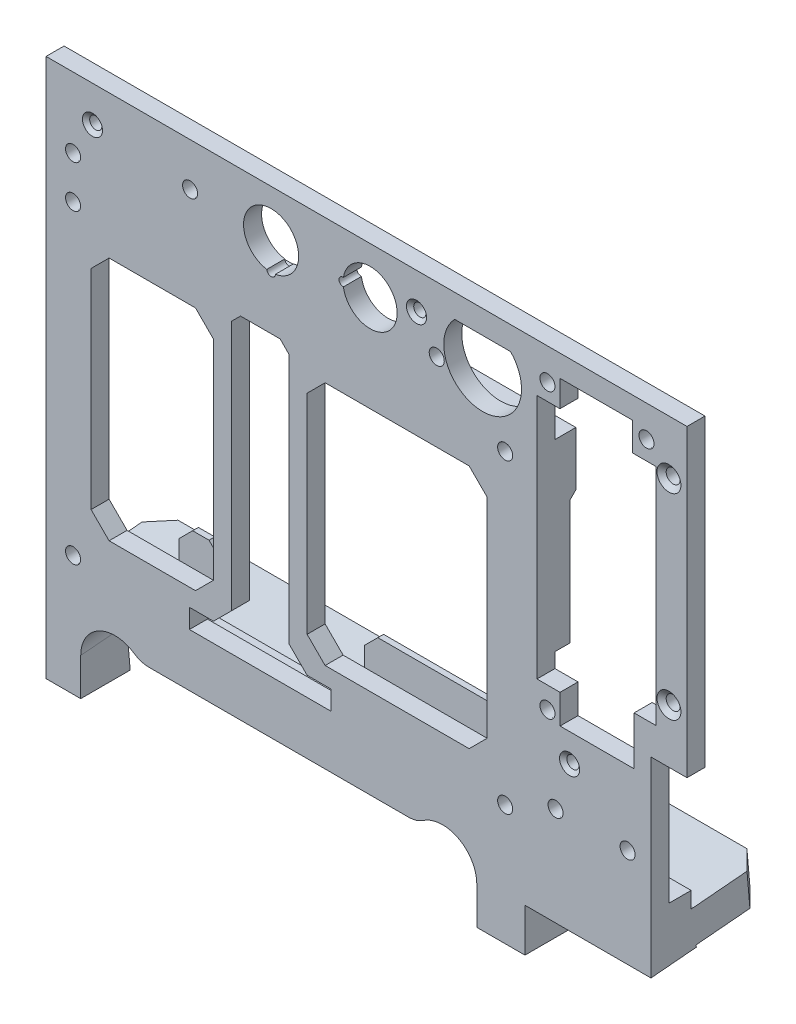
from build123d import *

# Parameters (mm, degrees)
BOSS_EXTRUDE1_DEPTH                               = 6.35
CSK_FOR_8_FLAT_HEAD_MACHINE_SCREW_100_D           = 4.9149
CSK_FOR_8_FLAT_HEAD_MACHINE_SCREW_100_CSINK_D     = 8.4328
CSK_FOR_8_FLAT_HEAD_MACHINE_SCREW_100_CSINK_ANGLE = 100
F_6_CLEARANCE_HOLE1_D                             = 4.3053
F_6_PLASTIC_INSERT_AT_2_COUNT                     = 2
F_6_PLASTIC_INSERT_AT_2_PITCH                     = 25.4
F_6_PLASTIC_INSERT_AT_3_COUNT                     = 2
F_6_PLASTIC_INSERT_AT_3_PITCH                     = 43.847198314
F_6_PLASTIC_INSERT_AT_4_COUNT                     = 2
F_6_PLASTIC_INSERT_AT_4_PITCH                     = 195.728385269
F_6_PLASTIC_INSERT_AT_5_COUNT                     = 2
F_6_PLASTIC_INSERT_AT_5_PITCH                     = 219.81275054
F_6_PLASTIC_INSERT_AT_6_COUNT                     = 2
F_6_PLASTIC_INSERT_AT_6_PITCH                     = 109.227383471
F_6_PLASTIC_INSERT_AT_7_COUNT                     = 2
F_6_PLASTIC_INSERT_AT_7_PITCH                     = 135.11667516
F_6_PLASTIC_INSERT_AT_8_COUNT                     = 2
F_6_PLASTIC_INSERT_AT_8_PITCH                     = 198.442579935
F_6_PLASTIC_INSERT_AT_9_COUNT                     = 2
F_6_PLASTIC_INSERT_AT_9_PITCH                     = 227.0125
F_6_PLASTIC_INSERT_AT_10_COUNT                    = 2
F_6_PLASTIC_INSERT_AT_10_PITCH                    = 40.413646983
F_6_PLASTIC_INSERT_AT_11_COUNT                    = 2
F_6_PLASTIC_INSERT_AT_11_PITCH                    = 131.96584911
F_6_PLASTIC_INSERT_AT_12_COUNT                    = 2
F_6_PLASTIC_INSERT_AT_12_PITCH                    = 129.077320166
EXTRUDE_THIN1_DEPTH                               = 5.334
SKETCH32_W                                        = 20.32
SKETCH32_H                                        = 104.32703176
CUT_EXTRUDE1_DEPTH                                = 2466.937509601
SKETCH46_W                                        = 50
SKETCH46_H                                        = 6.778216606
CUT_EXTRUDE2_DEPTH                                = 2466.937509601
SKETCH47_W                                        = 6.35
SKETCH47_H                                        = 20
CUT_EXTRUDE3_DEPTH                                = 5.334
CHAMFER1_SIZE                                     = 6.35
CHAMFER2_SIZE                                     = 3.175
SKETCH51_W                                        = 38.317668231
SKETCH51_H                                        = 13.297875423
CUT_EXTRUDE4_DEPTH                                = 5.334
BOSS_EXTRUDE6_REACH                               = 2467.938
SKETCH53_W                                        = 213.36
SKETCH53_H                                        = 34.925
CAVITY1_START                                     = -216.085930602
CAVITY1_OUTLINE_W                                 = 44.45
CAVITY1_OUTLINE_H                                 = 18.31517219
CAVITY1_DEPTH                                     = 17.38195068
CUT_EXTRUDE5_REACH                                = 2490.533
SKETCH54_W                                        = 2.919570665
SKETCH54_H                                        = 5.651221012
BOSS_EXTRUDE7_START                               = -213.36
BOSS_EXTRUDE7_DEPTH                               = 213.36
CUT_EXTRUDE6_DEPTH                                = 1.5875
CSK_FOR_8_FLAT_HEAD_MACHINE_SCREW_2_D             = 4.9149
CSK_FOR_8_FLAT_HEAD_MACHINE_SCREW_2_CSINK_D       = 15.6977334
CSK_FOR_8_FLAT_HEAD_MACHINE_SCREW_2_CSINK_ANGLE   = 100
CHAMFER4_SIZE                                     = 6.35
SKETCH59_W                                        = 74.081135827
SKETCH59_H                                        = 19.05
SKETCH59_W_2                                      = 172.129604807
SKETCH59_W_3                                      = 15.323166325
BOSS_EXTRUDE8_DEPTH                               = 2.032
CHAMFER5_SIZE                                     = 4.7625
CHAMFER6_SIZE                                     = 2.032
CSK_FOR_6_FLAT_HEAD_MACHINE_SCREW_100_D           = 4.3053
CSK_FOR_6_FLAT_HEAD_MACHINE_SCREW_100_CSINK_D     = 7.0866
CSK_FOR_6_FLAT_HEAD_MACHINE_SCREW_100_CSINK_ANGLE = 100


# Read off the part's stored shape, not the designer's step: Cavity1
with BuildPart() as part:
    # Sketch1 → Boss-Extrude1 (new body)
    with BuildSketch(Plane.XY.offset(-6.35)):
        Polygon((312.420000001, -2444.383004154), (312.420000001, -2396.543225166), (325.120000001, -2396.543225166), (325.120000001, -2289.228225166), (99.060000001, -2289.228225166), (99.060000001, -2444.383004154), align=None)
    extrude(amount=BOSS_EXTRUDE1_DEPTH)

    # CSK for _8 Flat Head Machine Screw _100 (through all)
    with Locations(Plane.XY):
        with Locations((318.770000001, -2308.278225166), (318.770000001, -2377.493225166)):
            CounterSinkHole(CSK_FOR_8_FLAT_HEAD_MACHINE_SCREW_100_D / 2, CSK_FOR_8_FLAT_HEAD_MACHINE_SCREW_100_CSINK_D / 2, counter_sink_angle=CSK_FOR_8_FLAT_HEAD_MACHINE_SCREW_100_CSINK_ANGLE)

    # #6 Clearance Hole1 (through all)
    with Locations(Plane(origin=(364.651150828, -2391.952939809, 0), x_dir=(1, 0, 0), z_dir=(0, 0, 1))):
        with Locations((-60.486150827, -37.292785356), (-85.886150827, -37.292785356), (-103.666150827, -44.912785356), (-256.066150827, -44.912785356), (-256.066150827, 63.037214644), (-103.666150827, 63.037214644), (-127.796150827, 79.864714644), (-214.791150827, 87.484714644), (-256.066150827, 77.959714644), (-88.743650827, 91.612214644), (-53.818650827, 91.612214644), (-88.743650827, -8.400285356)):
            Hole(F_6_CLEARANCE_HOLE1_D / 2)

    # Sketch5 → #6 Plastic Insert (revolve, cut)
    with BuildSketch(Plane(origin=(304.165000001, -2429.245725165, 0), x_dir=(0, -1, 0), z_dir=(1, 0, 0))):
        Polygon((0, 0), (0, 3.81), (2.5273, 3.81), (2.6543, 0), align=None)
    f_6_plastic_insert = revolve(axis=Axis((304.165000001, -2429.245725165, -110), (0, 0, 1)), mode=Mode.SUBTRACT)

    # #6 Plastic Insert at 2: #6 Plastic Insert ×2
    with Locations(*[(-i * F_6_PLASTIC_INSERT_AT_2_PITCH, 0, 0) for i in range(1, F_6_PLASTIC_INSERT_AT_2_COUNT)]):
        add(f_6_plastic_insert, mode=Mode.SUBTRACT)

    # #6 Plastic Insert at 3: #6 Plastic Insert ×2
    with Locations(*[Vector(-0.9847835588178597, -0.17378533390948422, 0) * (i * F_6_PLASTIC_INSERT_AT_3_PITCH) for i in range(1, F_6_PLASTIC_INSERT_AT_3_COUNT)]):
        add(f_6_plastic_insert, mode=Mode.SUBTRACT)

    # #6 Plastic Insert at 4: #6 Plastic Insert ×2
    with Locations(*[Vector(-0.9992418817088248, -0.038931501884812016, 0) * (i * F_6_PLASTIC_INSERT_AT_4_PITCH) for i in range(1, F_6_PLASTIC_INSERT_AT_4_COUNT)]):
        add(f_6_plastic_insert, mode=Mode.SUBTRACT)

    # #6 Plastic Insert at 5: #6 Plastic Insert ×2
    with Locations(*[Vector(-0.8897573026106963, 0.4564339409497698, 0) * (i * F_6_PLASTIC_INSERT_AT_5_PITCH) for i in range(1, F_6_PLASTIC_INSERT_AT_5_COUNT)]):
        add(f_6_plastic_insert, mode=Mode.SUBTRACT)

    # #6 Plastic Insert at 6: #6 Plastic Insert ×2
    with Locations(*[Vector(-0.39532211271238615, 0.9185425560095817, 0) * (i * F_6_PLASTIC_INSERT_AT_6_PITCH) for i in range(1, F_6_PLASTIC_INSERT_AT_6_COUNT)]):
        add(f_6_plastic_insert, mode=Mode.SUBTRACT)

    # #6 Plastic Insert at 7: #6 Plastic Insert ×2
    with Locations(*[Vector(-0.4981620508373131, 0.8670839469772015, 0) * (i * F_6_PLASTIC_INSERT_AT_7_PITCH) for i in range(1, F_6_PLASTIC_INSERT_AT_7_COUNT)]):
        add(f_6_plastic_insert, mode=Mode.SUBTRACT)

    # #6 Plastic Insert at 8: #6 Plastic Insert ×2
    with Locations(*[Vector(-0.7775800942042093, 0.6287839033383195, 0) * (i * F_6_PLASTIC_INSERT_AT_8_PITCH) for i in range(1, F_6_PLASTIC_INSERT_AT_8_COUNT)]):
        add(f_6_plastic_insert, mode=Mode.SUBTRACT)

    # #6 Plastic Insert at 9: #6 Plastic Insert ×2
    with Locations(*[Vector(-0.8615384615383548, 0.5076923076924889, 0) * (i * F_6_PLASTIC_INSERT_AT_9_PITCH) for i in range(1, F_6_PLASTIC_INSERT_AT_9_COUNT)]):
        add(f_6_plastic_insert, mode=Mode.SUBTRACT)

    # #6 Plastic Insert at 10: #6 Plastic Insert ×2
    with Locations(*[Vector(-0.6992068795866498, 0.7149193937351961, 0) * (i * F_6_PLASTIC_INSERT_AT_10_PITCH) for i in range(1, F_6_PLASTIC_INSERT_AT_10_COUNT)]):
        add(f_6_plastic_insert, mode=Mode.SUBTRACT)

    # #6 Plastic Insert at 11: #6 Plastic Insert ×2
    with Locations(*[Vector(-0.21412736848681804, 0.9768057483783101, 0) * (i * F_6_PLASTIC_INSERT_AT_11_PITCH) for i in range(1, F_6_PLASTIC_INSERT_AT_11_COUNT)]):
        add(f_6_plastic_insert, mode=Mode.SUBTRACT)

    # #6 Plastic Insert at 12: #6 Plastic Insert ×2
    with Locations(*[Vector(0.05165508542805467, 0.9986649849421079, 0) * (i * F_6_PLASTIC_INSERT_AT_12_PITCH) for i in range(1, F_6_PLASTIC_INSERT_AT_12_COUNT)]):
        add(f_6_plastic_insert, mode=Mode.SUBTRACT)

    # Sketch45 → Extrude-Thin1 (add)
    with BuildSketch(Plane(origin=(0, 0, -6.35), x_dir=(-1, 0, 0), z_dir=(0, 0, -1))):
        Polygon((-100.075698489, -2432.654973531), (-267.356135828, -2432.654973531), (-267.356135828, -2329.209217709), (-100.075698489, -2329.209217709), (-100.075698489, -2322.859217709), (-273.706135828, -2322.859217709), (-273.706135828, -2439.004973531), (-100.075698489, -2439.004973531), align=None)
    extrude(amount=EXTRUDE_THIN1_DEPTH)

    # Sketch32 → Cut-Extrude1 (cut, through all)
    with BuildSketch(Plane.XY):
        Polygon((197.485000001, -2426.070725165), (248.285000001, -2426.070725165), (254.635000001, -2419.720725165), (254.635000001, -2346.060725165), (248.285000001, -2339.710725165), (197.485000001, -2339.710725165), (191.135000001, -2346.060725165), (191.135000001, -2419.720725165), align=None)
        Polygon((151.765000001, -2426.070725165), (158.115000001, -2419.720725165), (158.115000001, -2346.060725165), (151.765000001, -2339.710725165), (121.285000001, -2339.710725165), (114.935000001, -2346.060725165), (114.935000001, -2419.720725165), (121.285000001, -2426.070725165), align=None)
        Polygon((280.343689385, -2403.134991124), (306.469670031, -2403.134991124), (306.469670031, -2386.058821704), (314.191806385, -2386.058821704), (314.191806385, -2306.934179288), (305.930299239, -2306.934179288), (305.930299239, -2296.930959818), (280.317676309, -2296.930959818), (280.317676309, -2306.227590766), (272.205303296, -2306.227590766), (272.205303296, -2392.824577262), (280.343689385, -2392.824577262), align=None)
        with Locations((174.625000001, -2386.413241045)):
            Rectangle(SKETCH32_W, SKETCH32_H)
        with BuildLine():
            Line((253.047500001, -2297.483225165), (243.180569174, -2297.483225165))
            ThreePointArc((243.180569174, -2297.483225165), (253.047500001, -2320.722522411), (262.914430827, -2297.483225165))
            Line((262.914430827, -2297.483225165), (253.047500001, -2297.483225165))
        make_face()
        with BuildLine():
            ThreePointArc((179.953905411, -2315.339871252), (178.435000001, -2296.017181949), (176.91609459, -2315.339871252))
            ThreePointArc((176.91609459, -2315.339871252), (178.435000001, -2316.784063181), (179.953905411, -2315.339871252))
        make_face()
        with BuildLine():
            ThreePointArc((203.940078519, -2307.181409511), (222.889832202, -2305.738225165), (203.940078519, -2304.29504082))
            ThreePointArc((203.940078519, -2304.29504082), (202.382804189, -2305.738225165), (203.940078519, -2307.181409511))
        make_face()
    extrude(amount=-CUT_EXTRUDE1_DEPTH, mode=Mode.SUBTRACT)

    # Sketch46 → Cut-Extrude2 (cut, through all)
    with BuildSketch(Plane(origin=(0, 0, -11.684), x_dir=(-1, 0, 0), z_dir=(0, 0, -1))):
        with Locations((-174.625000001, -2435.615865228)):
            Rectangle(SKETCH46_W, SKETCH46_H)
    extrude(amount=-CUT_EXTRUDE2_DEPTH, mode=Mode.SUBTRACT)

    # Sketch47 → Cut-Extrude3 (cut)
    with BuildSketch(Plane(origin=(0, 0, -11.684), x_dir=(-1, 0, 0), z_dir=(0, 0, -1))):
        with Locations((-270.531135828, -2397.654973531)):
            Rectangle(SKETCH47_W, SKETCH47_H)
    extrude(amount=-CUT_EXTRUDE3_DEPTH, mode=Mode.SUBTRACT)

    # Chamfer1
    chamfer1_edges = [part.edges().sort_by_distance(p)[0] for p in [
        (184.785000001, -2432.226756925, -3.175),
        (164.465000001, -2432.226756925, -3.175),
    ]]
    chamfer(chamfer1_edges, length=CHAMFER1_SIZE)

    # Chamfer2
    chamfer2_edges = [part.edges().sort_by_distance(p)[0] for p in [
        (164.465000001, -2334.249725165, -3.175),
        (184.785000001, -2334.249725165, -3.175),
    ]]
    chamfer(chamfer2_edges, length=CHAMFER2_SIZE)

    # Sketch51 → Cut-Extrude4 (cut)
    with BuildSketch(Plane(origin=(0, 0, -11.684), x_dir=(-1, 0, 0), z_dir=(0, 0, -1))):
        with Locations((-115.142999561, -2432.356035819)):
            Rectangle(SKETCH51_W, SKETCH51_H)
    extrude(amount=-CUT_EXTRUDE4_DEPTH, mode=Mode.SUBTRACT)

    # Boss-Extrude6: up to this plane
    boss_extrude6_end = Plane(origin=(312.420000001, -2462.662203908, -15.992028091), z_dir=(-1.0880998258086672e-13, 0.08715574274757297, -0.9961946980917531))
    # Sketch53 → Boss-Extrude6 (add, up to the surface)
    with BuildSketch(Plane.XY, mode=Mode.PRIVATE) as boss_extrude6_sk1:
        with Locations((205.740000001, -2461.845504154)):
            Rectangle(SKETCH53_W, SKETCH53_H)
    boss_extrude6_tool1 = split(extrude(boss_extrude6_sk1.sketch, amount=-BOSS_EXTRUDE6_REACH, mode=Mode.PRIVATE), bisect_by=boss_extrude6_end, keep=Keep.BOTH, mode=Mode.PRIVATE)
    add(boss_extrude6_tool1.solids().sort_by_distance((205.74, -2461.845504, 0))[0])

    # Cavity1 outline → Cavity1 (cut)
    with BuildSketch(Plane(origin=(0, 0, 0), x_dir=(1, 0, 0), z_dir=(0, 0.0871557427475733, -0.996194698091753)).offset(CAVITY1_START)):
        with BuildLine():
            Line((111.283750001, 2473), (111.283750001, 2456.71682781))
            ThreePointArc((111.283750001, 2456.71682781), (117.681009917, 2446.065961773), (130.088714334, 2446.709974869))
            ThreePointArc((130.088714334, 2446.709974869), (132.627947634, 2447.919562322), (135.409738808, 2448.33482781))
            Line((135.409738808, 2448.33482781), (226.857761194, 2448.33482781))
            ThreePointArc((226.857761194, 2448.33482781), (229.639552367, 2447.919562322), (232.178785667, 2446.709974869))
            ThreePointArc((232.178785667, 2446.709974869), (244.586490085, 2446.065961773), (250.983750001, 2456.71682781))
            Line((250.983750001, 2456.71682781), (250.983750001, 2473))
            Line((250.983750001, 2473), (111.283750001, 2473))
        make_face()
        with Locations((290.195000001, 2463.842413905)):
            Rectangle(CAVITY1_OUTLINE_W, CAVITY1_OUTLINE_H)
    extrude(amount=CAVITY1_DEPTH, mode=Mode.SUBTRACT)

    # Sketch54 → Cut-Extrude5 (cut, up to next)
    with BuildSketch(Plane(origin=(312.420000001, 0, 0), x_dir=(0, 0, -1), z_dir=(1, 0, 0)), mode=Mode.PRIVATE) as cut_extrude5_sk1:
        with Locations((15.620785333, -2447.20861466)):
            Rectangle(SKETCH54_W, SKETCH54_H)
    cut_extrude5_tool1 = extrude(cut_extrude5_sk1.sketch, amount=-CUT_EXTRUDE5_REACH, mode=Mode.PRIVATE) & part.part
    add(cut_extrude5_tool1.solids().sort_by_distance((312.42, -2447.208615, -15.620785))[0], mode=Mode.SUBTRACT)

    # Sketch55 → Boss-Extrude7 (add)
    with BuildSketch(Plane(origin=(312.420000001, 0, 0), x_dir=(0, 0, -1), z_dir=(1, 0, 0)).offset(BOSS_EXTRUDE7_START)):
        Polygon((14.887223108, -2450.034225166), (40.19056844, -2447.8204693), (41.229041316, -2459.690268595), (15.925695985, -2461.904024461), align=None)
    extrude(amount=BOSS_EXTRUDE7_DEPTH)

    # Sketch56 → Cut-Extrude6 (cut)
    with BuildSketch(Plane(origin=(0, -17.318192957, 197.947851288), x_dir=(1, 0, 0), z_dir=(-1.1933534284552054e-14, -0.08715574274760372, 0.9961946980917504))):
        with BuildLine():
            Line((111.611503566, -2453.923752241), (250.655996435, -2453.923752241))
            ThreePointArc((250.655996435, -2453.923752241), (243.306557322, -2445.477994601), (232.178785667, -2446.709974869))
            ThreePointArc((232.178785667, -2446.709974869), (229.639552367, -2447.919562322), (226.857761194, -2448.33482781))
            Line((226.857761194, -2448.33482781), (135.409738808, -2448.33482781))
            ThreePointArc((135.409738808, -2448.33482781), (132.627947634, -2447.919562322), (130.088714334, -2446.709974869))
            ThreePointArc((130.088714334, -2446.709974869), (118.960942679, -2445.477994601), (111.611503566, -2453.923752241))
        make_face()
    extrude(amount=-CUT_EXTRUDE6_DEPTH, mode=Mode.SUBTRACT)

    # CSK for _8 Flat Head Machine Screw _ 2 (through all)
    with Locations(Plane(origin=(0, -2444.585831504, -213.873547273), x_dir=(-1, 0, 0), z_dir=(-1.364009210293116e-13, -0.9961946980917507, -0.08715574274759999))):
        with Locations((-124.460000001, -186.230118761), (-205.740000001, -186.230118761), (-287.020000001, -186.230118761)):
            CounterSinkHole(CSK_FOR_8_FLAT_HEAD_MACHINE_SCREW_2_D / 2, CSK_FOR_8_FLAT_HEAD_MACHINE_SCREW_2_CSINK_D / 2, counter_sink_angle=CSK_FOR_8_FLAT_HEAD_MACHINE_SCREW_2_CSINK_ANGLE)

    # Chamfer4
    chamfer4_edges = [part.edges().sort_by_distance(p)[0] for p in [
        (312.420000001, -2453.755368947, -40.709804878),
        (99.060000001, -2453.755368947, -40.709804878),
    ]]
    chamfer(chamfer4_edges, length=CHAMFER4_SIZE)

    # Sketch59 → Boss-Extrude8 (add)
    with BuildSketch(Plane(origin=(0, 0, -11.684), x_dir=(-1, 0, 0), z_dir=(0, 0, -1))):
        with Locations((-236.665567915, -2429.479973531)):
            Rectangle(SKETCH59_W, SKETCH59_H)
        with Locations((-186.140500893, -2332.384217709)):
            Rectangle(SKETCH59_W_2, SKETCH59_H)
        with Locations((-141.963416838, -2429.479973531)):
            Rectangle(SKETCH59_W_3, SKETCH59_H)
    extrude(amount=BOSS_EXTRUDE8_DEPTH)

    # Chamfer5
    chamfer5_edges = [part.edges().sort_by_distance(p)[0] for p in [
        (199.625000001, -2419.954973531, -12.7),
        (100.075698489, -2341.909217709, -12.7),
        (134.301833676, -2419.954973531, -12.7),
        (149.625000001, -2419.954973531, -12.7),
    ]]
    chamfer(chamfer5_edges, length=CHAMFER5_SIZE)

    # Chamfer6
    chamfer6_edges = [part.edges().sort_by_distance(p)[0] for p in [
        (269.780719562, -2341.909217709, -11.684),
        (270.531135828, -2419.954973531, -11.684),
    ]]
    chamfer(chamfer6_edges, length=CHAMFER6_SIZE - 0.0001)  # a hair under: the kernel refuses the full size

    # CSK for #6 Flat Head Machine Screw (100)1 (through all)
    with Locations(Plane.XY):
        with Locations((229.72617421, -2301.928225166), (115.42617421, -2301.928225166), (283.722310037, -2413.053225166)):
            CounterSinkHole(CSK_FOR_6_FLAT_HEAD_MACHINE_SCREW_100_D / 2, CSK_FOR_6_FLAT_HEAD_MACHINE_SCREW_100_CSINK_D / 2, counter_sink_angle=CSK_FOR_6_FLAT_HEAD_MACHINE_SCREW_100_CSINK_ANGLE)


solid = part.part
